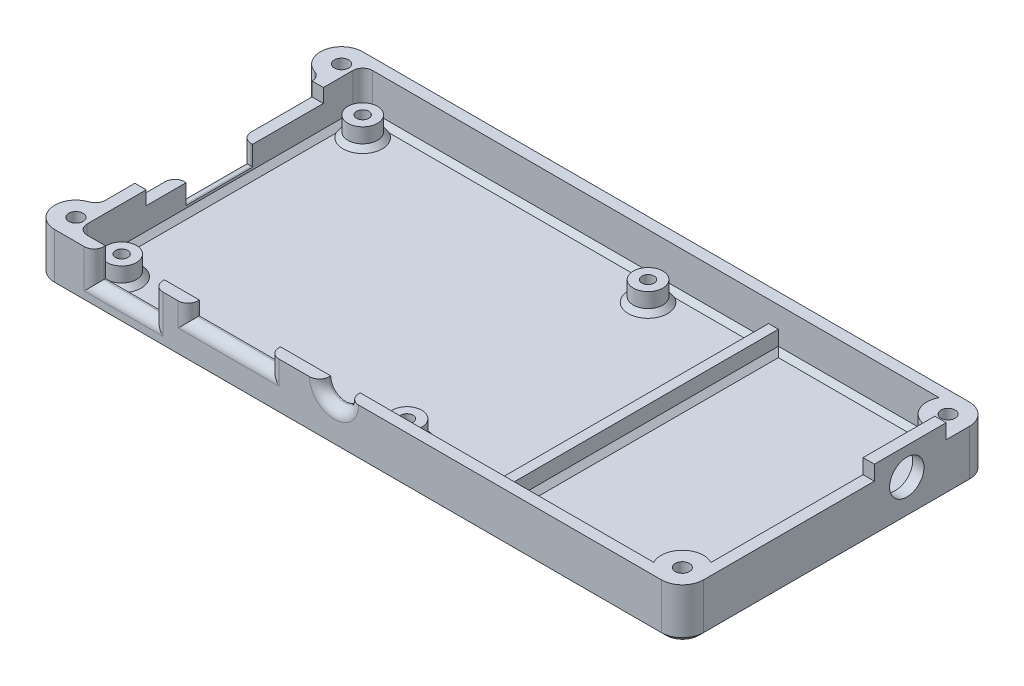
from build123d import *

# Parameters (mm, degrees)
SKETCH3_W                      = 127.6
SKETCH3_H                      = 62.6
SKETCH3_W_2                    = 123
SKETCH3_H_2                    = 58
BOSS_EXTRUDE1_DEPTH            = 10.3
SKETCH5_W                      = 123
SKETCH5_H                      = 58
BOSS_EXTRUDE2_DEPTH            = 2
SKETCH6_R                      = 3
BOSS_EXTRUDE3_DEPTH            = 4
F_2_5_2_5_DIAMETER_HOLE1_D     = 2.5
F_2_5_2_5_DIAMETER_HOLE1_DEPTH = 8
F_2_5_2_5_DIAMETER_HOLE1_TIP   = 0.751075774
SKETCH10_W                     = 2
SKETCH10_H                     = 58
BOSS_EXTRUDE4_DEPTH            = 4
CUT_EXTRUDE1_REACH             = 100.128
SKETCH11_R                     = 3
SKETCH11_W                     = 12
SKETCH11_H                     = 5.8
SKETCH11_W_2                   = 16.5
SKETCH11_H_2                   = 2.8
CUT_EXTRUDE2_REACH             = 134.558
SKETCH12_W                     = 13.5
SKETCH12_H                     = 6.8
SKETCH12_W_2                   = 36
SKETCH12_H_2                   = 2.8
FILLET6_R                      = 2
FILLET8_R                      = 2
CHAMFER1_SIZE                  = 1
FILLET9_R                      = 2
BOSS_EXTRUDE6_DEPTH            = 10.3
F_2_9_2_9_DIAMETER_HOLE2_D     = 2.9
F_2_9_2_9_DIAMETER_HOLE1_D     = 2.9
SKETCH24_R                     = 4.3
BOSS_EXTRUDE7_DEPTH            = 8.3
F_2_9_2_9_DIAMETER_HOLE5_D     = 2.9
F_2_9_2_9_DIAMETER_HOLE4_D     = 2.9
FILLET10_R                     = 4.3
FILLET18_R                     = 2
CHAMFER3_SIZE                  = 1
FILLET19_R                     = 2
FILLET20_R                     = 4.3
CHAMFER6_SIZE                  = 1
SKETCH29_W                     = 2.3
SKETCH29_H                     = 14.6
BOSS_EXTRUDE8_DEPTH            = 3
CUT_EXTRUDE3_REACH             = 161.862
SKETCH13_R                     = 3.5
CHAMFER7_SIZE                  = 1


# Some blends are built 0.0001 mm under size
with BuildPart() as part:
    # Sketch3 → Boss-Extrude1 (new body)
    with BuildSketch(Plane(origin=(0, 0, 0), x_dir=(1, 0, 0), z_dir=(0, 1, 0))):
        with Locations((-11.061766162, 3.105993834)):
            Rectangle(SKETCH3_W, SKETCH3_H)
        with Locations((-11.061766162, 3.105993834)):
            Rectangle(SKETCH3_W_2, SKETCH3_H_2, mode=Mode.SUBTRACT)
    extrude(amount=BOSS_EXTRUDE1_DEPTH)

    # Sketch5 → Boss-Extrude2 (add)
    with BuildSketch(Plane(origin=(0, 0, 0), x_dir=(1, 0, 0), z_dir=(0, 1, 0))):
        with Locations((-11.061766162, 3.105993834)):
            Rectangle(SKETCH5_W, SKETCH5_H)
    extrude(amount=BOSS_EXTRUDE2_DEPTH)

    # Sketch6 → Boss-Extrude3 (add)
    with BuildSketch(Plane(origin=(0, 2, 0), x_dir=(1, 0, 0), z_dir=(0, 1, 0))):
        with Locations(Location((-68.061766162, 27.605993834, 0), (0, 0, 270))):
            Circle(SKETCH6_R)
        with Locations(Location((-68.061766162, -21.394006166, 0), (0, 0, 270))):
            Circle(SKETCH6_R)
        with Locations(Location((-10.061766162, -21.394006166, 0), (0, 0, 270))):
            Circle(SKETCH6_R)
        with Locations(Location((-10.061766162, 27.605993834, 0), (0, 0, 270))):
            Circle(SKETCH6_R)
    extrude(amount=BOSS_EXTRUDE3_DEPTH)

    # Ø2.5 (2.5) Diameter Hole1
    with Locations(Plane(origin=(0, 6, 0), x_dir=(1, 0, 0), z_dir=(0, 1, 0))):
        with Locations((-68.061766162, 27.605993834), (-10.061766162, 27.605993834), (-10.061766162, -21.394006166), (-68.061766162, -21.394006166)):
            Hole(F_2_5_2_5_DIAMETER_HOLE1_D / 2, depth=F_2_5_2_5_DIAMETER_HOLE1_DEPTH)
            with Locations((0, 0, -(F_2_5_2_5_DIAMETER_HOLE1_DEPTH + F_2_5_2_5_DIAMETER_HOLE1_TIP / 2))):  # 118° drill point
                Cone(0, F_2_5_2_5_DIAMETER_HOLE1_D / 2, F_2_5_2_5_DIAMETER_HOLE1_TIP, mode=Mode.SUBTRACT)

    # Sketch10 → Boss-Extrude4 (add)
    with BuildSketch(Plane(origin=(0, 2, 0), x_dir=(1, 0, 0), z_dir=(0, 1, 0))):
        with Locations((10.938233838, 3.105993834)):
            Rectangle(SKETCH10_W, SKETCH10_H)
    extrude(amount=BOSS_EXTRUDE4_DEPTH)

    # Sketch11 → Cut-Extrude1 (cut, up to next)
    with BuildSketch(Plane.XY.offset(28.194006166), mode=Mode.PRIVATE) as cut_extrude1_sk1:
        with Locations((-18.061766162, 10.3)):
            Circle(SKETCH11_R)
    cut_extrude1_tool1 = extrude(cut_extrude1_sk1.sketch, amount=-CUT_EXTRUDE1_REACH, mode=Mode.PRIVATE) & part.part
    # Sketch11 → Cut-Extrude1 (cut, up to next)
    with BuildSketch(Plane.XY.offset(28.194006166), mode=Mode.PRIVATE) as cut_extrude1_sk2:
        with Locations((-60.861766162, 7.4)):
            Rectangle(SKETCH11_W, SKETCH11_H)
    cut_extrude1_tool2 = extrude(cut_extrude1_sk2.sketch, amount=-CUT_EXTRUDE1_REACH, mode=Mode.PRIVATE) & part.part
    # Sketch11 → Cut-Extrude1 (cut, up to next)
    with BuildSketch(Plane.XY.offset(28.194006166), mode=Mode.PRIVATE) as cut_extrude1_sk3:
        with Locations((-39.527982648, 8.9)):
            Rectangle(SKETCH11_W_2, SKETCH11_H_2)
    cut_extrude1_tool3 = extrude(cut_extrude1_sk3.sketch, amount=-CUT_EXTRUDE1_REACH, mode=Mode.PRIVATE) & part.part
    add(cut_extrude1_tool1.solids().sort_by_distance((-18.061766, 10.3, 28.194006))[0], mode=Mode.SUBTRACT)
    add(cut_extrude1_tool2.solids().sort_by_distance((-60.861766, 7.4, 28.194006))[0], mode=Mode.SUBTRACT)
    add(cut_extrude1_tool3.solids().sort_by_distance((-39.527983, 8.9, 28.194006))[0], mode=Mode.SUBTRACT)

    # Sketch12 → Cut-Extrude2 (cut, up to next)
    with BuildSketch(Plane.ZY.offset(74.861766162), mode=Mode.PRIVATE) as cut_extrude2_sk1:
        with Locations((-2.982922372, 6.9)):
            Rectangle(SKETCH12_W, SKETCH12_H)
    cut_extrude2_tool1 = extrude(cut_extrude2_sk1.sketch, amount=-CUT_EXTRUDE2_REACH, mode=Mode.PRIVATE) & part.part
    # Sketch12 → Cut-Extrude2 (cut, up to next)
    with BuildSketch(Plane.ZY.offset(74.861766162), mode=Mode.PRIVATE) as cut_extrude2_sk2:
        with Locations((-6.105993834, 8.9)):
            Rectangle(SKETCH12_W_2, SKETCH12_H_2)
    cut_extrude2_tool2 = extrude(cut_extrude2_sk2.sketch, amount=-CUT_EXTRUDE2_REACH, mode=Mode.PRIVATE) & part.part
    add(cut_extrude2_tool1.solids().sort_by_distance((-74.861766, 6.9, -2.982922))[0], mode=Mode.SUBTRACT)
    add(cut_extrude2_tool2.solids().sort_by_distance((-74.861766, 8.9, -6.105994))[0], mode=Mode.SUBTRACT)

    # Fillet6
    fillet6_edges = [part.edges().sort_by_distance(p)[0] for p in [
        (50.438233838, 6.15, -32.105993834),
    ]]
    fillet(fillet6_edges, radius=FILLET6_R)

    # Fillet8
    fillet8_edges = [part.edges().sort_by_distance(p)[0] for p in [
        (-72.561766162, 6.15, -32.105993834),
        (-72.561766162, 6.15, 25.894006166),
    ]]
    fillet(fillet8_edges, radius=FILLET8_R)

    # Chamfer1
    chamfer1_edges = [part.edges().sort_by_distance(p)[0] for p in [
        (-68.061766162, 2, -30.605993834),
        (-68.061766162, 2, 18.394006166),
        (-10.061766162, 2, 18.394006166),
        (-10.061766162, 2, -30.605993834),
    ]]
    chamfer(chamfer1_edges, length=CHAMFER1_SIZE)

    # Fillet9
    fillet9_edges = [part.edges().sort_by_distance(p)[0] for p in [
        (-60.861766162, 4.5, 28.194006166),
        (-54.861766162, 7.4, 28.194006166),
        (-47.777982648, 8.9, 28.194006166),
        (-39.527982648, 7.5, 28.194006166),
        (-31.277982648, 8.9, 28.194006166),
        (-18.061766162, 7.3, 28.194006166),
        (-74.861766162, 5.5, -9.732922372),
        (-74.861766162, 3.5, -2.982922372),
        (-74.861766162, 5.5, 3.767077628),
    ]]
    fillet(fillet9_edges, radius=FILLET9_R)

    # Sketch17 → Boss-Extrude6 (add)
    with BuildSketch(Plane(origin=(0, 0, 0), x_dir=(1, 0, 0), z_dir=(0, 1, 0))):
        with BuildLine():
            Line((-74.861766162, 34.405993834), (-74.861766162, 25.805993834))
            ThreePointArc((-74.861766162, 25.805993834), (-79.161766162, 30.105993834), (-74.861766162, 34.405993834))
        make_face()
        with BuildLine():
            Line((-74.861766162, -19.594006166), (-74.861766162, -28.194006166))
            ThreePointArc((-74.861766162, -28.194006166), (-79.161766162, -23.894006166), (-74.861766162, -19.594006166))
        make_face()
    extrude(amount=BOSS_EXTRUDE6_DEPTH)

    # Ø2.9 (2.9) Diameter Hole2 (through all)
    with Locations(Plane(origin=(0, 10.3, 0), x_dir=(1, 0, 0), z_dir=(0, 1, 0))):
        with Locations((-74.861766162, 30.105993834)):
            Hole(F_2_9_2_9_DIAMETER_HOLE2_D / 2)

    # Ø2.9 (2.9) Diameter Hole1 (through all)
    with Locations(Plane(origin=(0, 10.3, 0), x_dir=(1, 0, 0), z_dir=(0, 1, 0))):
        with Locations((-74.861766162, -23.894006166)):
            Hole(F_2_9_2_9_DIAMETER_HOLE1_D / 2)

    # Sketch24 → Boss-Extrude7 (add)
    with BuildSketch(Plane(origin=(0, 2, 0), x_dir=(1, 0, 0), z_dir=(0, 1, 0))):
        with Locations((48.418494527, -23.894006166)):
            Circle(SKETCH24_R)
        with Locations((48.418494527, 30.105993834)):
            Circle(SKETCH24_R)
    extrude(amount=BOSS_EXTRUDE7_DEPTH)

    # Ø2.9 (2.9) Diameter Hole5 (through all)
    with Locations(Plane(origin=(0, 10.3, 0), x_dir=(1, 0, 0), z_dir=(0, 1, 0))):
        with Locations((48.418494527, -23.894006166)):
            Hole(F_2_9_2_9_DIAMETER_HOLE5_D / 2)

    # Ø2.9 (2.9) Diameter Hole4 (through all)
    with Locations(Plane(origin=(0, 10.3, 0), x_dir=(1, 0, 0), z_dir=(0, 1, 0))):
        with Locations((48.418494527, 30.105993834)):
            Hole(F_2_9_2_9_DIAMETER_HOLE4_D / 2)

    # Fillet10
    fillet10_edges = [part.edges().sort_by_distance(p)[0] for p in [
        (52.738233838, 5.15, -34.405993834),
    ]]
    fillet(fillet10_edges, radius=FILLET10_R)

    # Fillet18
    fillet18_edges = [part.edges().sort_by_distance(p)[0] for p in [
        (-74.861766162, 5.15, -25.805993834),
        (-74.861766162, 5.15, 19.594006166),
    ]]
    fillet(fillet18_edges, radius=FILLET18_R)

    # Chamfer3
    chamfer3_edges = [part.edges().sort_by_distance(p)[0] for p in [
        (-79.105793795, 0, -30.797535193),
        (-13.211766162, 0, -34.405993834),
        (51.478792997, 0, -33.146552993),
        (-79.105793795, 0, 24.585547524),
        (-74.861766162, 0, -3.105993834),
        (-75.2385223, 0, 19.088261462),
        (-75.2385223, 0, -25.300249131),
        (52.738233838, 0, -0.955993834),
        (-11.061766162, 0, 28.194006166),
    ]]
    chamfer(chamfer3_edges, length=CHAMFER3_SIZE)

    # Fillet19
    fillet19_edges = [part.edges().sort_by_distance(p)[0] for p in [
        (-66.861766162, 6.4, 28.194006166),
    ]]
    fillet(fillet19_edges, radius=FILLET19_R)

    # Fillet20
    # the kernel refuses this fillet: 4.3 mm, written as the material it takes off along each edge
    with BuildSketch(Plane(origin=(52.738233838, -9.75, 28.194006166), x_dir=(-1, 0, 0), z_dir=(0, 1, 0))) as fillet20_piece_1:
        with BuildLine():
            CenterArc((FILLET20_R, -FILLET20_R), FILLET20_R, 90, 90)
            Line((0, -FILLET20_R), (0, 0))
            Line((0, 0), (FILLET20_R, 0))
        make_face()
    extrude(amount=30.8, mode=Mode.SUBTRACT)

    # Chamfer5
    # the kernel refuses this chamfer: 1 mm, written as the material it adds along each edge
    with BuildSketch(Plane(origin=(-72.561766162, 2, 23.894006166), x_dir=(-0.027495876610568366, 0.9996219169112972, 0), z_dir=(0, 0, -1))) as chamfer5_piece_1:
        with BuildLine():
            Line((1.028673195, 0), (-0.056547155, 1.027117794))
            Line((-0.056547155, 1.027117794), (-0.076539593, 1.026567876))
            ThreePointArc((-0.076539593, 1.026567876), (-0.034129227, 0.51339783), (-0.019992438, -0.000549918))
            Line((-0.019992438, -0.000549918), (0.000549918, -0.019992438))
            ThreePointArc((0.000549918, -0.019992438), (0.514497665, -0.00585565), (1.029223113, -0.019992438))
            Line((1.029223113, -0.019992438), (1.028673195, 0))
        make_face()
    extrude(amount=54)
    with BuildSketch(Plane(origin=(-70.561766162, 2, 23.894006166), x_dir=(0, 0, 1), z_dir=(1, 0, 0))) as chamfer5_piece_2:
        with BuildLine():
            Line((2.028284271, -1.028284271), (0.971715729, 0.028284271))
            Line((0.971715729, 0.028284271), (0.971715729, 0.048284271))
            ThreePointArc((0.971715729, 0.048284271), (1.485857864, 0.02), (2, 0.02))
            Line((2, 0.02), (2.02, 0))
            ThreePointArc((2.02, 0), (2.02, -0.514142136), (2.048284271, -1.028284271))
            Line((2.048284271, -1.028284271), (2.028284271, -1.028284271))
        make_face()
    revolve(axis=Axis((-70.561766162, 2, 23.894006166), (0, -1, 0)), revolution_arc=90)
    with BuildSketch(Plane(origin=(-70.561766162, 2, -30.105993834), x_dir=(0, 0, -1), z_dir=(1, 0, 0))) as chamfer5_piece_3:
        with BuildLine():
            Line((2.028284271, 1.028284271), (0.971715729, -0.028284271))
            Line((0.971715729, -0.028284271), (0.971715729, -0.048284271))
            ThreePointArc((0.971715729, -0.048284271), (1.485857864, -0.02), (2, -0.02))
            Line((2, -0.02), (2.02, 0))
            ThreePointArc((2.02, 0), (2.02, 0.514142136), (2.048284271, 1.028284271))
            Line((2.048284271, 1.028284271), (2.028284271, 1.028284271))
        make_face()
    revolve(axis=Axis((-70.561766162, 2, -30.105993834), (0, 1, 0)), revolution_arc=90)
    with BuildSketch(Plane(origin=(9.938233838, 2, 25.894006166), x_dir=(0, 0.999621916911297, 0.027495876610582174), z_dir=(-1, 0, 0)), Plane(origin=(-70.561766162, 2, -32.105993834), x_dir=(0, 0.9996219169112968, -0.027495876610589075), z_dir=(1, 0, 0))) as chamfer5_piece_4:
        with BuildLine():
            Line((1.028673195, 0), (-0.056547155, 1.027117794))
            Line((-0.056547155, 1.027117794), (-0.076539593, 1.026567876))
            ThreePointArc((-0.076539593, 1.026567876), (-0.034129227, 0.51339783), (-0.019992438, -0.000549918))
            Line((-0.019992438, -0.000549918), (0.000549918, -0.019992438))
            ThreePointArc((0.000549918, -0.019992438), (0.514497665, -0.00585565), (1.029223113, -0.019992438))
            Line((1.029223113, -0.019992438), (1.028673195, 0))
        make_face()
    extrude(amount=80.5)
    with BuildSketch(Plane(origin=(9.938233838, 2, 25.894006166), x_dir=(-0.9996219169112968, -0.027495876610586247, 0), z_dir=(0, 0, -1))) as chamfer5_piece_5:
        with BuildLine():
            Line((1.028673195, 0), (-0.056547155, 1.027117794))
            Line((-0.056547155, 1.027117794), (-0.076539593, 1.026567876))
            ThreePointArc((-0.076539593, 1.026567876), (-0.034129227, 0.51339783), (-0.019992438, -0.000549918))
            Line((-0.019992438, -0.000549918), (0.000549918, -0.019992438))
            ThreePointArc((0.000549918, -0.019992438), (0.514497665, -0.00585565), (1.029223113, -0.019992438))
            Line((1.029223113, -0.019992438), (1.028673195, 0))
        make_face()
    extrude(amount=58)
    with BuildSketch(Plane(origin=(11.938233838, 2, -32.105993834), x_dir=(-0.027495876610585623, 0.9996219169112968, 0), z_dir=(0, 0, 1))) as chamfer5_piece_6:
        with BuildLine():
            Line((1.028673195, 0), (-0.056547155, -1.027117794))
            Line((-0.056547155, -1.027117794), (-0.076539593, -1.026567876))
            ThreePointArc((-0.076539593, -1.026567876), (-0.034129227, -0.51339783), (-0.019992438, 0.000549918))
            Line((-0.019992438, 0.000549918), (0.000549918, 0.019992438))
            ThreePointArc((0.000549918, 0.019992438), (0.514497665, 0.00585565), (1.029223113, 0.019992438))
            Line((1.029223113, 0.019992438), (1.028673195, 0))
        make_face()
    extrude(amount=58)
    with BuildSketch(Plane(origin=(11.938233838, 2, -32.105993834), x_dir=(0, 0.999621916911297, -0.027495876610582174), z_dir=(1, 0, 0))) as chamfer5_piece_7_section:
        with BuildLine():
            Line((1.028673195, 0), (-0.056547155, 1.027117794))
            Line((-0.056547155, 1.027117794), (-0.076539593, 1.026567876))
            ThreePointArc((-0.076539593, 1.026567876), (-0.034129227, 0.51339783), (-0.019992438, -0.000549918))
            Line((-0.019992438, -0.000549918), (0.000549918, -0.019992438))
            ThreePointArc((0.000549918, -0.019992438), (0.514497665, -0.00585565), (1.029223113, -0.019992438))
            Line((1.029223113, -0.019992438), (1.028673195, 0))
        make_face()
    chamfer5_piece_7 = extrude(amount=35.245370415, mode=Mode.PRIVATE)
    chamfer5_piece_7 = chamfer5_piece_7 - Plane(origin=(48.418494527, 2.330215388, -30.105993834), x_dir=(1, 0, 0), z_dir=(0, -1, 0)) * Cylinder(4.3, 75, mode=Mode.PRIVATE)
    add(chamfer5_piece_7)
    with BuildSketch(Plane(origin=(12.509916826, 2, 25.894006166), x_dir=(0, 0.9996219169112968, 0.027495876610585623), z_dir=(-1, 0, 0))) as chamfer5_piece_8a_section:
        with BuildLine():
            Line((1.028673195, 0), (-0.056547155, 1.027117794))
            Line((-0.056547155, 1.027117794), (-0.076539593, 1.026567876))
            ThreePointArc((-0.076539593, 1.026567876), (-0.034129227, 0.51339783), (-0.019992438, -0.000549918))
            Line((-0.019992438, -0.000549918), (0.000549918, -0.019992438))
            ThreePointArc((0.000549918, -0.019992438), (0.514497665, -0.00585565), (1.029223113, -0.019992438))
            Line((1.029223113, -0.019992438), (1.028673195, 0))
        make_face()
    chamfer5_piece_8a = extrude(amount=83.071682988, mode=Mode.PRIVATE)
    chamfer5_piece_8a = split(chamfer5_piece_8a, bisect_by=Plane(origin=(9.938233838, 2.329793627, 25.564212539), z_dir=(1, 0, 0)), keep=Keep.TOP, mode=Mode.PRIVATE)
    with BuildSketch(Plane(origin=(9.938233838, 2, 28.465689154), x_dir=(-0.9996219169112968, -0.027495876610586296, 0), z_dir=(0, 0, -1))) as chamfer5_piece_8b_section:
        with BuildLine():
            Line((1.028673195, 0), (-0.056547155, 1.027117794))
            Line((-0.056547155, 1.027117794), (-0.076539593, 1.026567876))
            ThreePointArc((-0.076539593, 1.026567876), (-0.034129227, 0.51339783), (-0.019992438, -0.000549918))
            Line((-0.019992438, -0.000549918), (0.000549918, -0.019992438))
            ThreePointArc((0.000549918, -0.019992438), (0.514497665, -0.00585565), (1.029223113, -0.019992438))
            Line((1.029223113, -0.019992438), (1.028673195, 0))
        make_face()
    chamfer5_piece_8b = extrude(amount=60.571682988, mode=Mode.PRIVATE)
    chamfer5_piece_8b = split(chamfer5_piece_8b, bisect_by=Plane(origin=(9.608440211, 2.329793627, 25.894006166), z_dir=(0, 0, 1)), keep=Keep.TOP, mode=Mode.PRIVATE)
    chamfer5_piece_8 = chamfer5_piece_8a & chamfer5_piece_8b
    add(chamfer5_piece_8)
    with BuildSketch(Plane(origin=(-70.561766162, 2, -32.105993834), x_dir=(0, 0.9996219169112968, -0.027495876610589075), z_dir=(1, 0, 0))) as chamfer5_piece_9a_section:
        with BuildLine():
            Line((1.028673195, 0), (-0.056547155, 1.027117794))
            Line((-0.056547155, 1.027117794), (-0.076539593, 1.026567876))
            ThreePointArc((-0.076539593, 1.026567876), (-0.034129227, 0.51339783), (-0.019992438, -0.000549918))
            Line((-0.019992438, -0.000549918), (0.000549918, -0.019992438))
            ThreePointArc((0.000549918, -0.019992438), (0.514497665, -0.00585565), (1.029223113, -0.019992438))
            Line((1.029223113, -0.019992438), (1.028673195, 0))
        make_face()
    chamfer5_piece_9a = extrude(amount=83.071682988, mode=Mode.PRIVATE)
    chamfer5_piece_9a = split(chamfer5_piece_9a, bisect_by=Plane(origin=(9.938233838, 2.329793627, -31.776200208), z_dir=(1, 0, 0)), keep=Keep.TOP, mode=Mode.PRIVATE)
    with BuildSketch(Plane(origin=(9.938233838, 2, 25.894006166), x_dir=(-0.9996219169112968, -0.027495876610586247, 0), z_dir=(0, 0, -1))) as chamfer5_piece_9b_section:
        with BuildLine():
            Line((1.028673195, 0), (-0.056547155, 1.027117794))
            Line((-0.056547155, 1.027117794), (-0.076539593, 1.026567876))
            ThreePointArc((-0.076539593, 1.026567876), (-0.034129227, 0.51339783), (-0.019992438, -0.000549918))
            Line((-0.019992438, -0.000549918), (0.000549918, -0.019992438))
            ThreePointArc((0.000549918, -0.019992438), (0.514497665, -0.00585565), (1.029223113, -0.019992438))
            Line((1.029223113, -0.019992438), (1.028673195, 0))
        make_face()
    chamfer5_piece_9b = extrude(amount=60.571682988, mode=Mode.PRIVATE)
    chamfer5_piece_9b = split(chamfer5_piece_9b, bisect_by=Plane(origin=(9.608440211, 2.329793627, -32.105993834), z_dir=(0, 0, -1)), keep=Keep.TOP, mode=Mode.PRIVATE)
    chamfer5_piece_9 = chamfer5_piece_9a & chamfer5_piece_9b
    add(chamfer5_piece_9)
    with BuildSketch(Plane(origin=(9.36655085, 2, -32.105993834), x_dir=(0, 0.9996219169112968, -0.027495876610589075), z_dir=(1, 0, 0))) as chamfer5_piece_10a_section:
        with BuildLine():
            Line((1.028673195, 0), (-0.056547155, 1.027117794))
            Line((-0.056547155, 1.027117794), (-0.076539593, 1.026567876))
            ThreePointArc((-0.076539593, 1.026567876), (-0.034129227, 0.51339783), (-0.019992438, -0.000549918))
            Line((-0.019992438, -0.000549918), (0.000549918, -0.019992438))
            ThreePointArc((0.000549918, -0.019992438), (0.514497665, -0.00585565), (1.029223113, -0.019992438))
            Line((1.029223113, -0.019992438), (1.028673195, 0))
        make_face()
    chamfer5_piece_10a = extrude(amount=37.817053403, mode=Mode.PRIVATE)
    chamfer5_piece_10a = split(chamfer5_piece_10a, bisect_by=Plane(origin=(11.938233838, 2.329793627, -31.776200208), z_dir=(-1, 0, 0)), keep=Keep.TOP, mode=Mode.PRIVATE)
    with BuildSketch(Plane(origin=(11.938233838, 2, -34.677676822), x_dir=(-0.027495876610585623, 0.9996219169112968, 0), z_dir=(0, 0, 1))) as chamfer5_piece_10b_section:
        with BuildLine():
            Line((1.028673195, 0), (-0.056547155, -1.027117794))
            Line((-0.056547155, -1.027117794), (-0.076539593, -1.026567876))
            ThreePointArc((-0.076539593, -1.026567876), (-0.034129227, -0.51339783), (-0.019992438, 0.000549918))
            Line((-0.019992438, 0.000549918), (0.000549918, 0.019992438))
            ThreePointArc((0.000549918, 0.019992438), (0.514497665, 0.00585565), (1.029223113, 0.019992438))
            Line((1.029223113, 0.019992438), (1.028673195, 0))
        make_face()
    chamfer5_piece_10b = extrude(amount=60.571682988, mode=Mode.PRIVATE)
    chamfer5_piece_10b = split(chamfer5_piece_10b, bisect_by=Plane(origin=(12.268027465, 2.329793627, -32.105993834), z_dir=(0, 0, -1)), keep=Keep.TOP, mode=Mode.PRIVATE)
    chamfer5_piece_10 = chamfer5_piece_10a & chamfer5_piece_10b
    add(chamfer5_piece_10)

    # Chamfer6
    chamfer6_edges = [part.edges().sort_by_distance(p)[0] for p in [
        (50.438233838, 2, -3.105993834),
    ]]
    chamfer(chamfer6_edges, length=CHAMFER6_SIZE)

    # Sketch29 → Boss-Extrude8 (add)
    with BuildSketch(Plane(origin=(0, 10.3, 0), x_dir=(1, 0, 0), z_dir=(0, 1, 0))):
        with Locations((51.588233838, 18.105993834)):
            Rectangle(SKETCH29_W, SKETCH29_H)
    extrude(amount=BOSS_EXTRUDE8_DEPTH)

    # Sketch13 → Cut-Extrude3 (cut, up to next)
    with BuildSketch(Plane(origin=(52.738233838, 0, -61.144227672), x_dir=(0, 0, -1), z_dir=(1, 0, 0)), mode=Mode.PRIVATE) as cut_extrude3_sk1:
        with Locations((-43.738233838, 7.722271929)):
            Circle(SKETCH13_R)
    cut_extrude3_tool1 = extrude(cut_extrude3_sk1.sketch, amount=-CUT_EXTRUDE3_REACH, mode=Mode.PRIVATE) & part.part
    add(cut_extrude3_tool1.solids().sort_by_distance((52.738234, 7.722272, -17.405994))[0], mode=Mode.SUBTRACT)

    # Chamfer7
    chamfer7_edges = [part.edges().sort_by_distance(p)[0] for p in [
        (51.478792997, 0, 26.934565325),
    ]]
    chamfer(chamfer7_edges, length=CHAMFER7_SIZE - 0.0001)  # a hair under: the kernel refuses the full size


solid = part.part
